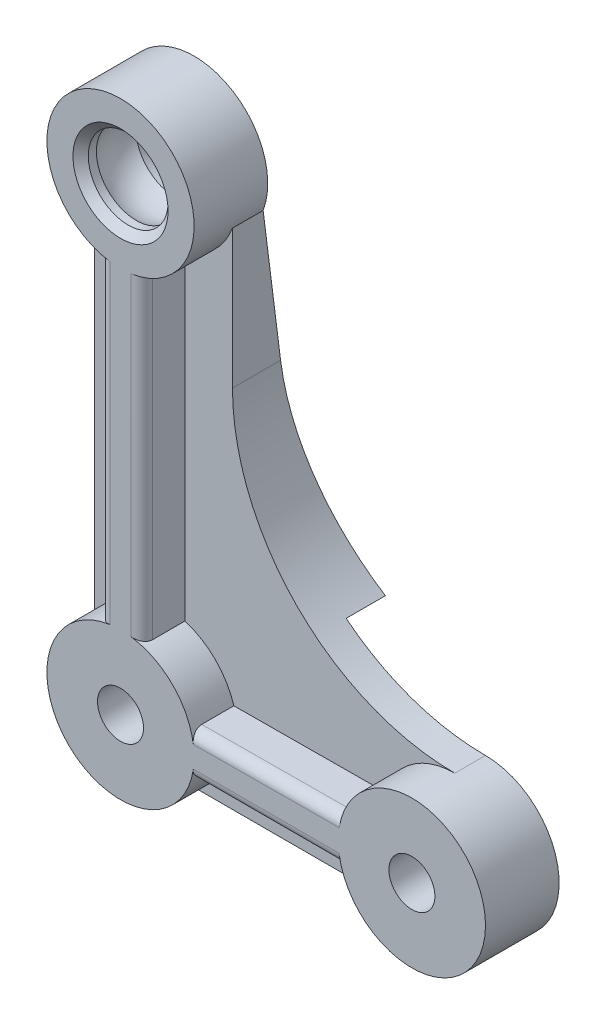
from build123d import *

# Parameters (mm, degrees)
SKETCH_1_R            = 1.5
SKETCH_1_R_2          = 2.6
EXTRUDE_1_DEPTH       = 2
SKETCH_2_R            = 1.5
SKETCH_2_R_2          = 2.6
EXTRUDE_2_DEPTH       = 2.8
FILLET_1_R            = 0.7
EXTRUDE_START         = -4.5
EXTRUDE_3_DEPTH       = 7
EXTRUDE_START_2       = 2.5
EXTRUDE_3_2_DEPTH     = 7.413746647
EXTRUDE_START_3       = -4
EXTRUDE_3_3_OUTLINE_R = 1.5
EXTRUDE_3_3_DEPTH     = 4
CHAMFER_1_SIZE        = 0.5


with BuildPart() as part:
    # 草图1 → 凸台-拉伸1 (new body)
    with BuildSketch(Plane.XY):
        with BuildLine():
            Line((4.5, 19.3), (4.5, 28.329670691))
            ThreePointArc((4.5, 28.329670691), (0, 34.8), (-4.5, 28.329670691))
            Line((-4.5, 28.329670691), (-4.5, 1.670329309))
            ThreePointArc((-4.5, 1.670329309), (-3.39411255, -3.39411255), (1.670329309, -4.5))
            Line((1.670329309, -4.5), (17.329670691, -4.5))
            ThreePointArc((17.329670691, -4.5), (23.724404724, -0.848528137), (19, 4.8))
            ThreePointArc((19, 4.8), (8.746951673, 9.046951673), (4.5, 19.3))
        make_face()
        Circle(SKETCH_1_R, mode=Mode.SUBTRACT)
        with Locations((19, 0)):
            Circle(SKETCH_1_R, mode=Mode.SUBTRACT)
        with Locations((0, 30)):
            Circle(SKETCH_1_R_2, mode=Mode.SUBTRACT)
    extrude(amount=EXTRUDE_1_DEPTH)

    # 草图2 → 凸台-拉伸2 (add)
    with BuildSketch(Plane.XY.offset(2)):
        with BuildLine():
            Line((-1.4, 25.408703887), (-1.4, 4.591296113))
            ThreePointArc((-1.4, 4.591296113), (-3.39411255, -3.39411255), (4.591296113, -1.4))
            Line((4.591296113, -1.4), (14.408703887, -1.4))
            ThreePointArc((14.408703887, -1.4), (23.799903071, -0.030504201), (14.426868498, 1.458241497))
            Line((14.426868498, 1.458241497), (4.591296113, 1.4))
            ThreePointArc((4.591296113, 1.4), (3.39411255, 3.39411255), (1.4, 4.591296113))
            Line((1.4, 4.591296113), (1.4, 25.408703887))
            ThreePointArc((1.4, 25.408703887), (0, 34.8), (-1.4, 25.408703887))
        make_face()
        Circle(SKETCH_2_R, mode=Mode.SUBTRACT)
        with Locations((0, 30)):
            Circle(SKETCH_2_R_2, mode=Mode.SUBTRACT)
        with Locations((19, 0)):
            Circle(SKETCH_2_R, mode=Mode.SUBTRACT)
    extrude(amount=EXTRUDE_2_DEPTH)

    # 圆角1
    fillet_1_edges = [part.edges().sort_by_distance(p)[0] for p in [
        (-1.4, 15, 4.8),
        (9.5, -1.4, 4.8),
        (9.509082305, 1.429120748, 4.8),
        (1.4, 15, 4.8),
    ]]
    fillet(fillet_1_edges, radius=FILLET_1_R)

    # 凸台-拉伸3: read off the stored shape, not the designer's step
    # 凸台-拉伸3 outline → 凸台-拉伸3 (add)
    with BuildSketch(Plane.YZ.offset(EXTRUDE_START)):
        Polygon((28.329670691, 0), (8, 0), (8, -2.561025334), align=None)
    extrude(amount=EXTRUDE_3_DEPTH)

    # Extrude 3 2 outline → Extrude 3 2 (add)
    with BuildSketch(Plane.YZ.offset(EXTRUDE_START_2)):
        Polygon((28.329670691, 0), (8, 0), (8, -2.561025334), align=None)
    extrude(amount=EXTRUDE_3_2_DEPTH)

    # Extrude 3 3 outline → Extrude 3 3 (cut)
    # profile 1 of 3: a face of its own
    with BuildSketch(Plane.XY.offset(EXTRUDE_START_3)):
        with BuildLine():
            ThreePointArc((4.5, 19.3), (5.923290291, 13.035044837), (9.913746647, 8))
            Line((9.913746647, 8), (9.913746647, 28.329670691))
            Line((9.913746647, 28.329670691), (4.5, 28.329670691))
            Line((4.5, 28.329670691), (4.5, 19.3))
        make_face()
    # profile 2 of 3: a face of its own
    with BuildSketch(Plane.XY.offset(EXTRUDE_START_3)):
        with BuildLine():
            ThreePointArc((6.976689308, 8), (5.469210572, 9.857132985), (4.246086412, 11.912711334))
            ThreePointArc((4.246086412, 11.912711334), (3.209776536, 12.39709927), (2.5, 11.5))
            Line((2.5, 11.5), (2.5, 8))
            Line((2.5, 8), (-4.5, 8))
            Line((-4.5, 8), (-4.5, 1.670329309))
            ThreePointArc((-4.5, 1.670329309), (-3.39411255, -3.39411255), (1.670329309, -4.5))
            Line((1.670329309, -4.5), (17.329670691, -4.5))
            ThreePointArc((17.329670691, -4.5), (23.724404724, -0.848528137), (19, 4.8))
            ThreePointArc((19, 4.8), (14.183362168, 5.62337761), (9.913746647, 8))
            Line((9.913746647, 8), (6.976689308, 8))
        make_face()
        Circle(EXTRUDE_3_3_OUTLINE_R, mode=Mode.SUBTRACT)
        with Locations((19, 0)):
            Circle(EXTRUDE_3_3_OUTLINE_R, mode=Mode.SUBTRACT)
    # profile 3 of 3: a face of its own
    with BuildSketch(Plane.XY.offset(EXTRUDE_START_3)):
        with BuildLine():
            Line((1.992485884, 28.329670691), (-1.992485884, 28.329670691))
            ThreePointArc((-1.992485884, 28.329670691), (0, 27.4), (1.992485884, 28.329670691))
        make_face()
    extrude(amount=EXTRUDE_3_3_DEPTH, mode=Mode.SUBTRACT)

    # 草图6 → 切除-旋转1 (revolve, cut)
    with BuildSketch(Plane(origin=(0, 0, 0), x_dir=(0, 0, -1), z_dir=(1, 0, 0))):
        with BuildLine():
            Line((-5.3904059, 30), (0.4095941, 30))
            ThreePointArc((0.4095941, 30), (-2.4904059, 32.9), (-5.3904059, 30))
        make_face()
    revolve(axis=Axis((0, 30, 4.8), (0, 0, -1)), mode=Mode.SUBTRACT)

    # 倒角1
    chamfer_1_edges = [part.edges().sort_by_distance(p)[0] for p in [
        (-2.6, 30, 4.8),
    ]]
    chamfer(chamfer_1_edges, length=CHAMFER_1_SIZE)


solid = part.part
